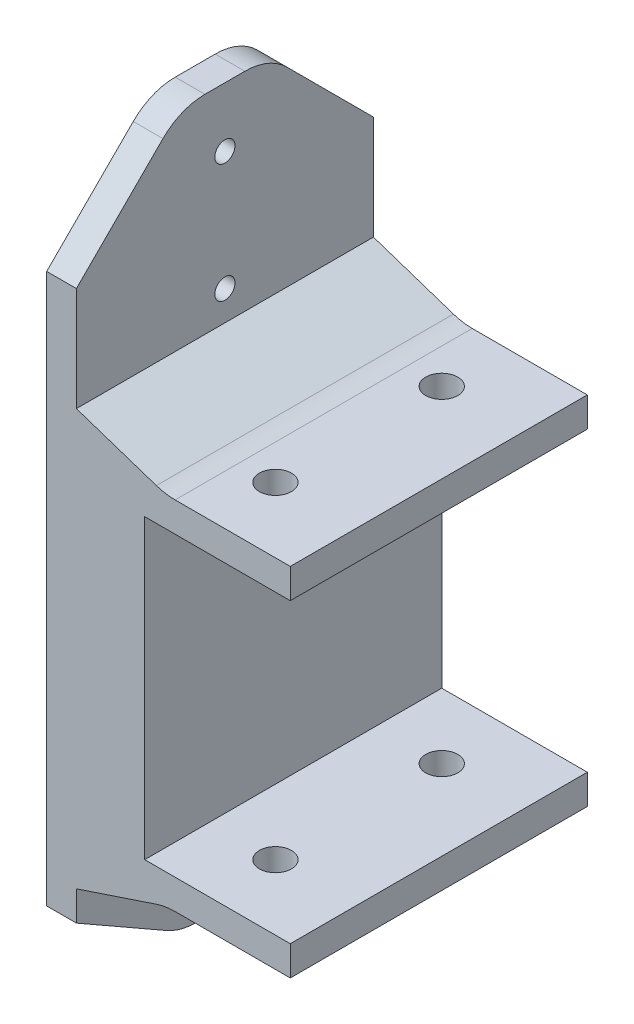
from build123d import *

# Parameters (mm, degrees)
BOSS_EXTRUDE1_DEPTH     = 50
SKETCH3_R               = 1.7
CUT_EXTRUDE1_DEPTH      = 114.22985472
CHAMFER1_SIZE           = 5
CHAMFER1_SIZE2          = 15
CHAMFER2_SIZE           = 15
CHAMFER2_SIZE2          = 5
FILLET1_R               = 10
CUT_EXTRUDE2_DEPTH      = 115.917361613
CUT_EXTRUDE2_DEPTH_BACK = 115.917361613
SKETCH5_R               = 2.7


with BuildPart() as part:
    # Sketch1 → Boss-Extrude1 (new body)
    with BuildSketch(Plane.XY):
        Polygon((0, 0), (0, -5), (-36, -5), (-36, -25), (-41, -25), (-41, 95), (-36, 95), (-36, 55), (0, 55), (0, 50), (-24.5, 50), (-24.5, 0), align=None)
    extrude(amount=BOSS_EXTRUDE1_DEPTH)

    # Sketch3 → Cut-Extrude1 (cut, through all)
    with BuildSketch(Plane(origin=(-36, 0, 0), x_dir=(0, 0, -1), z_dir=(1, 0, 0))):
        Polygon((-50, 95), (-50, 77.5), (-32.5, 95), align=None)
        Polygon((-17.5, 95), (0, 77.5), (0, 95), align=None)
        Polygon((-32.5, -25), (-50, -15), (-50, -25), align=None)
        Polygon((0, -25), (0, -15), (-17.5, -25), align=None)
        with Locations((-25, 65)):
            Circle(SKETCH3_R)
        with Locations((-25, 85)):
            Circle(SKETCH3_R)
        with Locations((-25, -15)):
            Circle(SKETCH3_R)
    extrude(amount=-CUT_EXTRUDE1_DEPTH, mode=Mode.SUBTRACT)

    # Chamfer1
    chamfer1_edges = [part.edges().sort_by_distance(p)[0] for p in [
        (-36, -5, 25),
    ]]
    chamfer1_side = [part.faces().sort_by_distance(p)[0] for p in [
        (-36, -10, 0.538516481),
    ]]
    chamfer(chamfer1_edges, length=CHAMFER1_SIZE, length2=CHAMFER1_SIZE2, reference=chamfer1_side[0])

    # Chamfer2
    chamfer2_edges = [part.edges().sort_by_distance(p)[0] for p in [
        (-36, 55, 25),
    ]]
    chamfer2_side = [part.faces().sort_by_distance(p)[0] for p in [
        (-18, 55, 25),
    ]]
    chamfer(chamfer2_edges, length=CHAMFER2_SIZE, length2=CHAMFER2_SIZE2, reference=chamfer2_side[0])

    # Fillet1
    fillet1_edges = [part.edges().sort_by_distance(p)[0] for p in [
        (-21, -5, 25),
        (-21, 55, 25),
        (-38.5, -25, 32.5),
        (-38.5, -25, 17.5),
        (-38.5, 95, 32.5),
        (-38.5, 95, 17.5),
    ]]
    fillet(fillet1_edges, radius=FILLET1_R)

    # Sketch5 → Cut-Extrude2 (cut, two sides: drawn at the far end of the back side and taken through both)
    with BuildSketch(Plane(origin=(0, 0, 0), x_dir=(1, 0, 0), z_dir=(0, 1, 0)).offset(-CUT_EXTRUDE2_DEPTH_BACK)):
        with Locations((-13.5, -11)):
            Circle(SKETCH5_R)
        with Locations((-13.5, -39)):
            Circle(SKETCH5_R)
    extrude(amount=CUT_EXTRUDE2_DEPTH + CUT_EXTRUDE2_DEPTH_BACK, mode=Mode.SUBTRACT)


solid = part.part
